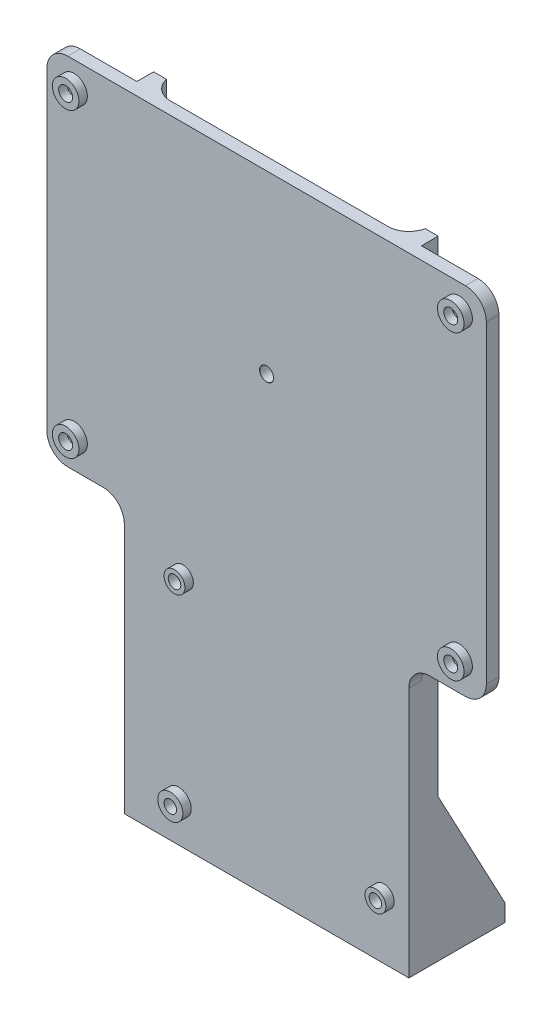
from build123d import *

# Parameters (mm, degrees)
SKETCH_1_W                        = 68
SKETCH_1_H                        = 65
EXTRUDE_1_DEPTH                   = 3
SKETCH_2_W                        = 3
SKETCH_2_H                        = 150
EXTRUDE_2_DEPTH                   = 4
SKETCH_3_W                        = 68
SKETCH_3_H                        = 4
EXTRUDE_3_DEPTH                   = 20
EXTRUDE_4_DEPTH                   = 3
EXTRUDE_START                     = -68
EXTRUDE_5_DEPTH                   = 3
SKETCH_5_R                        = 1.65
CUT_EXTRUDE_1_DEPTH               = 20
HOLE_WIZARD_3_3_3_3_1_D           = 3.3
HOLE_WIZARD_3_3_3_3_1_CSINK_D     = 3.35
HOLE_WIZARD_3_3_3_3_1_CSINK_ANGLE = 100
SKETCH_8_R                        = 1.5
CUT_EXTRUDE_2_DEPTH               = 131.240162776
SKETCH_9_R                        = 3.175
SKETCH_9_R_2                      = 1.675
EXTRUDE_6_DEPTH                   = 2
EXTRUDE_6_2_DEPTH                 = 2
EXTRUDE_6_3_DEPTH                 = 2
EXTRUDE_6_4_DEPTH                 = 2
SKETCH_9_R_3                      = 3
SKETCH_9_R_4                      = 1.5
EXTRUDE_6_5_DEPTH                 = 2
SKETCH_9_R_5                      = 2.5
EXTRUDE_6_6_DEPTH                 = 2
EXTRUDE_6_7_DEPTH                 = 2
FILLET_1_R                        = 5


with BuildPart() as part:
    # 草图1 → 凸台-拉伸1 (new body)
    with BuildSketch(Plane.XY):
        Polygon((-52.5, 32.5), (-34, 32.5), (34, 32.5), (52.5, 32.5), (52.5, 117.5), (-52.5, 117.5), align=None)
        Rectangle(SKETCH_1_W, SKETCH_1_H)
    extrude(amount=EXTRUDE_1_DEPTH)

    # 草图2 → 凸台-拉伸2 (add)
    with BuildSketch(Plane(origin=(0, 0, 0), x_dir=(-1, 0, 0), z_dir=(0, 0, -1))):
        with Locations((-32.5, 42.5)):
            Rectangle(SKETCH_2_W, SKETCH_2_H)
        with Locations((32.5, 42.5)):
            Rectangle(SKETCH_2_W, SKETCH_2_H)
    extrude(amount=EXTRUDE_2_DEPTH)

    # 草图3 → 凸台-拉伸3 (add)
    with BuildSketch(Plane(origin=(0, 0, 0), x_dir=(-1, 0, 0), z_dir=(0, 0, -1))):
        with Locations((0, -30.5)):
            Rectangle(SKETCH_3_W, SKETCH_3_H)
    extrude(amount=EXTRUDE_3_DEPTH)

    # 草图4 → 凸台-拉伸4 (add)
    with BuildSketch(Plane(origin=(34, 0, 0), x_dir=(0, 0, -1), z_dir=(1, 0, 0))):
        Polygon((4, -28.5), (20, -28.5), (4, 1.5), align=None)
    extrude(amount=-EXTRUDE_4_DEPTH)

    # 草图4<2> → 凸台-拉伸5 (add)
    with BuildSketch(Plane(origin=(34, 0, 0), x_dir=(0, 0, -1), z_dir=(1, 0, 0)).offset(EXTRUDE_START)):
        Polygon((4, -28.5), (20, -28.5), (4, 1.5), align=None)
    extrude(amount=EXTRUDE_5_DEPTH)

    # 草图5 → 切除-拉伸1 (cut)
    with BuildSketch(Plane(origin=(0, -28.5, 0), x_dir=(1, 0, 0), z_dir=(0, 1, 0))):
        with Locations(Location((-17.5, 15, 0), (0, 0, 270))):
            Circle(SKETCH_5_R)
        with Locations(Location((17.5, 15, 0), (0, 0, 270))):
            Circle(SKETCH_5_R)
    extrude(amount=-CUT_EXTRUDE_1_DEPTH, mode=Mode.SUBTRACT)

    # Ø3.3 (3.3) 直径孔1 (through all)
    with Locations(Plane.XY.offset(3)):
        with Locations((-46, 111.5), (0, 75.5), (46, 111.5), (-46, 39.5), (46, 39.5)):
            CounterSinkHole(HOLE_WIZARD_3_3_3_3_1_D / 2, HOLE_WIZARD_3_3_3_3_1_CSINK_D / 2, counter_sink_angle=HOLE_WIZARD_3_3_3_3_1_CSINK_ANGLE)

    # 草图8 → 切除-拉伸2 (cut, through all)
    with BuildSketch(Plane(origin=(0, 0, 0), x_dir=(-1, 0, 0), z_dir=(0, 0, -1))):
        with Locations((21, -23.5)):
            Circle(SKETCH_8_R)
        with Locations((-28, -18.5)):
            Circle(SKETCH_8_R)
        with Locations((20, 23.5)):
            Circle(SKETCH_8_R)
    extrude(amount=-CUT_EXTRUDE_2_DEPTH, mode=Mode.SUBTRACT)

    # 圆角1
    # the kernel refuses this fillet: 5 mm, written as the material it adds along each edge
    with BuildSketch(Plane(origin=(-31, -28.5, 0), x_dir=(0, 0, -1), z_dir=(0, 1, 0))) as fillet_1_piece_1_section:
        with BuildLine():
            CenterArc((FILLET_1_R, -FILLET_1_R), FILLET_1_R, 90, 90)
            Line((0, -FILLET_1_R), (0, 0))
            Line((0, 0), (FILLET_1_R, 0))
        make_face()
    fillet_1_piece_1 = extrude(amount=146, mode=Mode.PRIVATE)
    fillet_1_piece_1 = split(fillet_1_piece_1, bisect_by=Plane(origin=(-31.029561629, -10.672563195, -10.492033704), z_dir=(0, -0.4705882352941177, 0.8823529411764706)), keep=Keep.TOP, mode=Mode.PRIVATE)
    fillet_1_piece_1 = split(fillet_1_piece_1, bisect_by=Plane(origin=(-31.029561629, -13.904733041, -4), z_dir=(0, 0, -1)), keep=Keep.TOP, mode=Mode.PRIVATE)
    add(fillet_1_piece_1)
    with BuildSketch(Plane(origin=(-31, -28.5, 0), x_dir=(0, 0, -1), z_dir=(0, 1, 0))) as fillet_1_piece_2_section:
        with BuildLine():
            CenterArc((FILLET_1_R, -FILLET_1_R), FILLET_1_R, 90, 90)
            Line((0, -FILLET_1_R), (0, 0))
            Line((0, 0), (FILLET_1_R, 0))
        make_face()
    fillet_1_piece_2 = extrude(amount=146, mode=Mode.PRIVATE)
    fillet_1_piece_2 = split(fillet_1_piece_2, bisect_by=Plane(origin=(-29.810583617, -6.75580101, -8.403093872), z_dir=(0, -0.4705882352941177, 0.8823529411764706)), keep=Keep.TOP, mode=Mode.PRIVATE)
    fillet_1_piece_2 = split(fillet_1_piece_2, bisect_by=Plane(origin=(-29.810583617, -10.698092045, -4), z_dir=(0, 0, 1)), keep=Keep.TOP, mode=Mode.PRIVATE)
    add(fillet_1_piece_2)
    with BuildSketch(Plane(origin=(-31, -28.5, 0), x_dir=(0, 0, -1), z_dir=(0, 1, 0))) as fillet_1_piece_3_section:
        with BuildLine():
            CenterArc((FILLET_1_R, -FILLET_1_R), FILLET_1_R, 90, 90)
            Line((0, -FILLET_1_R), (0, 0))
            Line((0, 0), (FILLET_1_R, 0))
        make_face()
    fillet_1_piece_3 = extrude(amount=146, mode=Mode.PRIVATE)
    fillet_1_piece_3 = split(fillet_1_piece_3, bisect_by=Plane(origin=(-29.85363948, 50.002505129, 21.868002735), z_dir=(0, 0.4705882352941177, -0.8823529411764706)), keep=Keep.TOP, mode=Mode.PRIVATE)
    fillet_1_piece_3 = split(fillet_1_piece_3, bisect_by=Plane(origin=(-29.85363948, 62.240011281, -4), z_dir=(0, 0, 1)), keep=Keep.TOP, mode=Mode.PRIVATE)
    add(fillet_1_piece_3)
    with BuildSketch(Plane(origin=(31, -28.5, 0), x_dir=(-1, 0, 0), z_dir=(0, 1, 0))) as fillet_1_piece_4_section:
        with BuildLine():
            CenterArc((FILLET_1_R, -FILLET_1_R), FILLET_1_R, 90, 90)
            Line((0, -FILLET_1_R), (0, 0))
            Line((0, 0), (FILLET_1_R, 0))
        make_face()
    fillet_1_piece_4 = extrude(amount=146, mode=Mode.PRIVATE)
    fillet_1_piece_4 = fillet_1_piece_4 - Plane(origin=(28, -18.5, -1.02503775), x_dir=(-1, 0, 0), z_dir=(0, 0, -1)) * Cylinder(1.5, 312, mode=Mode.PRIVATE)
    fillet_1_piece_4 = split(fillet_1_piece_4, bisect_by=Plane(origin=(29.837200994, -6.644507865, -8.343737528), z_dir=(0, -0.4705882352941177, 0.8823529411764706)), keep=Keep.TOP, mode=Mode.PRIVATE)
    fillet_1_piece_4 = split(fillet_1_piece_4, bisect_by=Plane(origin=(29.837200994, -10.547814413, -4), z_dir=(0, 0, 1)), keep=Keep.TOP, mode=Mode.PRIVATE)
    add(fillet_1_piece_4)
    with BuildSketch(Plane(origin=(31, -28.5, 0), x_dir=(-1, 0, 0), z_dir=(0, 1, 0))) as fillet_1_piece_5_section:
        with BuildLine():
            CenterArc((FILLET_1_R, -FILLET_1_R), FILLET_1_R, 90, 90)
            Line((0, -FILLET_1_R), (0, 0))
            Line((0, 0), (FILLET_1_R, 0))
        make_face()
    fillet_1_piece_5 = extrude(amount=146, mode=Mode.PRIVATE)
    fillet_1_piece_5 = split(fillet_1_piece_5, bisect_by=Plane(origin=(31.029561629, -10.672563195, -10.492033704), z_dir=(0, -0.4705882352941177, 0.8823529411764706)), keep=Keep.TOP, mode=Mode.PRIVATE)
    fillet_1_piece_5 = split(fillet_1_piece_5, bisect_by=Plane(origin=(31.029561629, -13.904733041, -4), z_dir=(0, 0, -1)), keep=Keep.TOP, mode=Mode.PRIVATE)
    add(fillet_1_piece_5)
    with BuildSketch(Plane(origin=(31, -28.5, 0), x_dir=(-1, 0, 0), z_dir=(0, 1, 0))) as fillet_1_piece_6_section:
        with BuildLine():
            CenterArc((FILLET_1_R, -FILLET_1_R), FILLET_1_R, 90, 90)
            Line((0, -FILLET_1_R), (0, 0))
            Line((0, 0), (FILLET_1_R, 0))
        make_face()
    fillet_1_piece_6 = extrude(amount=146, mode=Mode.PRIVATE)
    fillet_1_piece_6 = split(fillet_1_piece_6, bisect_by=Plane(origin=(29.85363948, 50.002505129, 21.868002735), z_dir=(0, 0.4705882352941177, -0.8823529411764706)), keep=Keep.TOP, mode=Mode.PRIVATE)
    fillet_1_piece_6 = split(fillet_1_piece_6, bisect_by=Plane(origin=(29.85363948, 62.240011281, -4), z_dir=(0, 0, 1)), keep=Keep.TOP, mode=Mode.PRIVATE)
    add(fillet_1_piece_6)
    with BuildSketch(Plane(origin=(34, 32.5, 0), x_dir=(1, 0, 0), z_dir=(0, 0, 1))) as fillet_1_piece_7:
        with BuildLine():
            CenterArc((FILLET_1_R, -FILLET_1_R), FILLET_1_R, 90, 90)
            Line((0, -FILLET_1_R), (0, 0))
            Line((0, 0), (FILLET_1_R, 0))
        make_face()
    extrude(amount=3)
    with BuildSketch(Plane(origin=(-34, 32.5, 0), x_dir=(-1, 0, 0), z_dir=(0, 0, 1))) as fillet_1_piece_8:
        with BuildLine():
            CenterArc((FILLET_1_R, FILLET_1_R), FILLET_1_R, 180, 90)
            Line((0, FILLET_1_R), (0, 0))
            Line((0, 0), (FILLET_1_R, 0))
        make_face()
    extrude(amount=3)
    # the kernel refuses this fillet: 5 mm, written as the material it takes off along each edge
    with BuildSketch(Plane(origin=(52.5, 32.5, -12.5), x_dir=(-1, 0, 0), z_dir=(0, 0, 1))) as fillet_1_2_piece_1:
        with BuildLine():
            CenterArc((FILLET_1_R, -FILLET_1_R), FILLET_1_R, 90, 90)
            Line((0, -FILLET_1_R), (0, 0))
            Line((0, 0), (FILLET_1_R, 0))
        make_face()
    extrude(amount=28, mode=Mode.SUBTRACT)
    with BuildSketch(Plane(origin=(-52.5, 32.5, -12.5), x_dir=(1, 0, 0), z_dir=(0, 0, 1)), Plane(origin=(-52.5, 117.5, -12.5), x_dir=(0, -1, 0), z_dir=(0, 0, 1)), Plane(origin=(52.5, 117.5, -12.5), x_dir=(-1, 0, 0), z_dir=(0, 0, 1))) as fillet_1_2_piece_2:
        with BuildLine():
            CenterArc((FILLET_1_R, FILLET_1_R), FILLET_1_R, 180, 90)
            Line((0, FILLET_1_R), (0, 0))
            Line((0, 0), (FILLET_1_R, 0))
        make_face()
    extrude(amount=28, mode=Mode.SUBTRACT)


with BuildPart() as body_2:
    # 草图9 → 凸台-拉伸6 (new body)
    with BuildSketch(Plane.XY.offset(3)):
        with Locations((-46, 111.5)):
            Circle(SKETCH_9_R)
        with Locations((-46, 111.5)):
            Circle(SKETCH_9_R_2, mode=Mode.SUBTRACT)
    extrude(amount=EXTRUDE_6_DEPTH)


with BuildPart() as body_3:
    # 草图9 → Extrude 6 2 (new body)
    with BuildSketch(Plane.XY.offset(3)):
        with Locations((46, 111.5)):
            Circle(SKETCH_9_R)
        with Locations((46, 111.5)):
            Circle(SKETCH_9_R_2, mode=Mode.SUBTRACT)
    extrude(amount=EXTRUDE_6_2_DEPTH)


with BuildPart() as body_4:
    # 草图9 → Extrude 6 3 (new body)
    with BuildSketch(Plane.XY.offset(3)):
        with Locations((46, 39.5)):
            Circle(SKETCH_9_R)
        with Locations((46, 39.5)):
            Circle(SKETCH_9_R_2, mode=Mode.SUBTRACT)
    extrude(amount=EXTRUDE_6_3_DEPTH)


with BuildPart() as body_5:
    # 草图9 → Extrude 6 4 (new body)
    with BuildSketch(Plane.XY.offset(3)):
        with Locations((-46, 39.5)):
            Circle(SKETCH_9_R)
        with Locations((-46, 39.5)):
            Circle(SKETCH_9_R_2, mode=Mode.SUBTRACT)
    extrude(amount=EXTRUDE_6_4_DEPTH)


with BuildPart() as body_6:
    # 草图9 → Extrude 6 5 (new body)
    with BuildSketch(Plane.XY.offset(3)):
        with Locations((-21, -23.5)):
            Circle(SKETCH_9_R_3)
        with Locations((-21, -23.5)):
            Circle(SKETCH_9_R_4, mode=Mode.SUBTRACT)
    extrude(amount=EXTRUDE_6_5_DEPTH)


with BuildPart() as body_7:
    # 草图9 → Extrude 6 6 (new body)
    with BuildSketch(Plane.XY.offset(3)):
        with Locations((-20, 23.5)):
            Circle(SKETCH_9_R_5)
        with Locations((-20, 23.5)):
            Circle(SKETCH_9_R_4, mode=Mode.SUBTRACT)
    extrude(amount=EXTRUDE_6_6_DEPTH)


with BuildPart() as body_8:
    # 草图9 → Extrude 6 7 (new body)
    with BuildSketch(Plane.XY.offset(3)):
        with Locations((28, -18.5)):
            Circle(SKETCH_9_R_5)
        with Locations((28, -18.5)):
            Circle(SKETCH_9_R_4, mode=Mode.SUBTRACT)
    extrude(amount=EXTRUDE_6_7_DEPTH)


solid = Compound([part.part, body_2.part, body_3.part, body_4.part, body_5.part, body_6.part, body_7.part, body_8.part])
